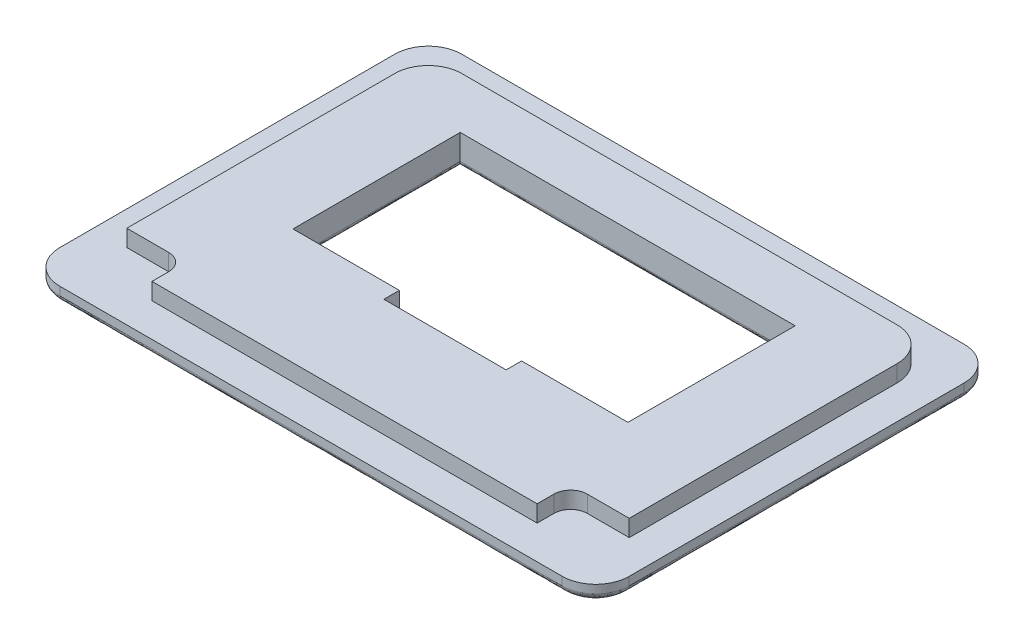
from build123d import *

# Parameters (mm, degrees)
BOSS_EXTRUDE1_DEPTH = 2
BOSS_EXTRUDE2_DEPTH = 1
CUT_EXTRUDE1_DEPTH  = 21.90454496
CUT_EXTRUDE2_DEPTH  = 1
FILLET2_SIZE        = 0.5


with BuildPart() as part:
    # Sketch4 → Boss-Extrude1 (new body)
    with BuildSketch(Plane(origin=(0, 0, 0), x_dir=(1, 0, 0), z_dir=(0, 1, 0))):
        with BuildLine():
            Line((-11.5, -10), (11.5, -10))
            Line((11.5, -10), (11.5, -9))
            ThreePointArc((11.5, -9), (11.792893219, -8.292893219), (12.5, -8))
            Line((12.5, -8), (15, -8))
            Line((15, -8), (15, 8))
            ThreePointArc((15, 8), (14.414213562, 9.414213562), (13, 10))
            Line((13, 10), (-13, 10))
            ThreePointArc((-13, 10), (-14.414213562, 9.414213562), (-15, 8))
            Line((-15, 8), (-15, -8))
            Line((-15, -8), (-12.5, -8))
            ThreePointArc((-12.5, -8), (-11.792893219, -8.292893219), (-11.5, -9))
            Line((-11.5, -9), (-11.5, -10))
        make_face()
    extrude(amount=BOSS_EXTRUDE1_DEPTH)

    # Sketch3 → Boss-Extrude2 (add)
    with BuildSketch(Plane(origin=(0, 0, 0), x_dir=(1, 0, 0), z_dir=(0, 1, 0))):
        with BuildLine():
            Line((-15, -12), (15, -12))
            ThreePointArc((15, -12), (16.414213562, -11.414213562), (17, -10))
            Line((17, -10), (17, 10))
            ThreePointArc((17, 10), (16.414213562, 11.414213562), (15, 12))
            Line((15, 12), (-15, 12))
            ThreePointArc((-15, 12), (-16.414213562, 11.414213562), (-17, 10))
            Line((-17, 10), (-17, -10))
            ThreePointArc((-17, -10), (-16.414213562, -11.414213562), (-15, -12))
        make_face()
    extrude(amount=BOSS_EXTRUDE2_DEPTH)

    # Sketch5 → Cut-Extrude1 (cut, through all)
    with BuildSketch(Plane(origin=(0, 2, 0), x_dir=(1, 0, 0), z_dir=(0, 1, 0))):
        Polygon((-3.65, -4), (3.65, -4), (3.65, -3.07690339), (10, -3.07690339), (10, 6.907955435), (-10, 6.907955435), (-10, -3.07690339), (-3.65, -3.07690339), align=None)
    extrude(amount=-CUT_EXTRUDE1_DEPTH, mode=Mode.SUBTRACT)

    # Sketch7 → Cut-Extrude2 (cut)
    with BuildSketch(Plane.XZ):
        Polygon((-4.219296387, 3.374825997), (-3.922380048, 3.374825997), (-3.922380048, 4.304303233), (3.922380048, 4.304303233), (3.922380048, 3.374825997), (4.219296387, 3.374825997), (4.219296387, 0.844582412), (-4.219296387, 0.844582412), align=None)
    extrude(amount=-CUT_EXTRUDE2_DEPTH, mode=Mode.SUBTRACT)

    # Fillet2
    # a fillet whose section is not a circle: 0.5 mm, written as the material it takes off along each edge
    with BuildSketch(Plane(origin=(17, 0, 10), x_dir=(-1, 0, 0), z_dir=(0, 0, -1)), Plane(origin=(-17, 0, -10), x_dir=(1, 0, 0), z_dir=(0, 0, 1))) as fillet2_piece_1:
        with BuildLine():
            Bezier((FILLET2_SIZE, 0), (0, 0), (0, FILLET2_SIZE), weights=[1, 0.353553391, 1])
            Line((0, FILLET2_SIZE), (0, 0))
            Line((0, 0), (FILLET2_SIZE, 0))
        make_face()
    extrude(amount=20, mode=Mode.SUBTRACT)
    with BuildSketch(Plane(origin=(15, 0, -10), x_dir=(1, 0, 0), z_dir=(0, 0, 1))) as fillet2_piece_2:
        with BuildLine():
            Bezier((2 - FILLET2_SIZE, 0), (2, 0), (2, FILLET2_SIZE), weights=[1, 0.353553391, 1])
            Line((2, FILLET2_SIZE), (2, 0))
            Line((2, 0), (2 - FILLET2_SIZE, 0))
        make_face()
    revolve(axis=Axis((15, 0, -10), (0, 1, 0)), revolution_arc=90, mode=Mode.SUBTRACT)
    with BuildSketch(Plane(origin=(15, 0, -12), x_dir=(0, 0, 1), z_dir=(-1, 0, 0)), Plane(origin=(-15, 0, 12), x_dir=(0, 0, -1), z_dir=(1, 0, 0))) as fillet2_piece_3:
        with BuildLine():
            Bezier((FILLET2_SIZE, 0), (0, 0), (0, FILLET2_SIZE), weights=[1, 0.353553391, 1])
            Line((0, FILLET2_SIZE), (0, 0))
            Line((0, 0), (FILLET2_SIZE, 0))
        make_face()
    extrude(amount=30, mode=Mode.SUBTRACT)
    with BuildSketch(Plane(origin=(-15, 0, -10), x_dir=(0, 0, -1), z_dir=(1, 0, 0))) as fillet2_piece_4:
        with BuildLine():
            Bezier((2 - FILLET2_SIZE, 0), (2, 0), (2, FILLET2_SIZE), weights=[1, 0.353553391, 1])
            Line((2, FILLET2_SIZE), (2, 0))
            Line((2, 0), (2 - FILLET2_SIZE, 0))
        make_face()
    revolve(axis=Axis((-15, 0, -10), (0, 1, 0)), revolution_arc=90, mode=Mode.SUBTRACT)
    with BuildSketch(Plane(origin=(-15, 0, 10), x_dir=(-1, 0, 0), z_dir=(0, 0, -1))) as fillet2_piece_5:
        with BuildLine():
            Bezier((2 - FILLET2_SIZE, 0), (2, 0), (2, FILLET2_SIZE), weights=[1, 0.353553391, 1])
            Line((2, FILLET2_SIZE), (2, 0))
            Line((2, 0), (2 - FILLET2_SIZE, 0))
        make_face()
    revolve(axis=Axis((-15, 0, 10), (0, 1, 0)), revolution_arc=90, mode=Mode.SUBTRACT)
    with BuildSketch(Plane(origin=(15, 0, 10), x_dir=(0, 0, 1), z_dir=(-1, 0, 0))) as fillet2_piece_6:
        with BuildLine():
            Bezier((2 - FILLET2_SIZE, 0), (2, 0), (2, FILLET2_SIZE), weights=[1, 0.353553391, 1])
            Line((2, FILLET2_SIZE), (2, 0))
            Line((2, 0), (2 - FILLET2_SIZE, 0))
        make_face()
    revolve(axis=Axis((15, 0, 10), (0, 1, 0)), revolution_arc=90, mode=Mode.SUBTRACT)
    with BuildSketch(Plane(origin=(4.219296387, 0, 3.374825997), x_dir=(1, 0, 0), z_dir=(0, 0, -1)), Plane(origin=(-4.219296387, 0, 1.82690339), x_dir=(-1, 0, 0), z_dir=(0, 0, 1))) as fillet2_piece_7:
        with BuildLine():
            Bezier((FILLET2_SIZE, 0), (0, 0), (0, -FILLET2_SIZE), weights=[1, 0.353553391, 1])
            Line((0, -FILLET2_SIZE), (0, 0))
            Line((0, 0), (FILLET2_SIZE, 0))
        make_face()
    extrude(amount=1.547922607, mode=Mode.SUBTRACT)
    with BuildSketch(Plane(origin=(2.672380048, 0, 3.374825997), x_dir=(0, 0, 1), z_dir=(1, 0, 0)), Plane(origin=(-4.219296387, 0, 3.374825997), x_dir=(0, 0, 1), z_dir=(1, 0, 0))) as fillet2_piece_8:
        with BuildLine():
            Bezier((FILLET2_SIZE, 0), (0, 0), (0, -FILLET2_SIZE), weights=[1, 0.353553391, 1])
            Line((0, -FILLET2_SIZE), (0, 0))
            Line((0, 0), (FILLET2_SIZE, 0))
        make_face()
    extrude(amount=1.546916339, mode=Mode.SUBTRACT)
    with BuildSketch(Plane(origin=(3.922380048, 0, 4.304303233), x_dir=(1, 0, 0), z_dir=(0, 0, -1)), Plane(origin=(-3.922380048, 0, 2.124825997), x_dir=(-1, 0, 0), z_dir=(0, 0, 1))) as fillet2_piece_9:
        with BuildLine():
            Bezier((FILLET2_SIZE, 0), (0, 0), (0, -FILLET2_SIZE), weights=[1, 0.353553391, 1])
            Line((0, -FILLET2_SIZE), (0, 0))
            Line((0, 0), (FILLET2_SIZE, 0))
        make_face()
    extrude(amount=2.179477235, mode=Mode.SUBTRACT)
    with BuildSketch(Plane(origin=(-3.922380048, 0, 4.304303233), x_dir=(0, 0, 1), z_dir=(1, 0, 0))) as fillet2_piece_10:
        with BuildLine():
            Bezier((FILLET2_SIZE, 0), (0, 0), (0, -FILLET2_SIZE), weights=[1, 0.353553391, 1])
            Line((0, -FILLET2_SIZE), (0, 0))
            Line((0, 0), (FILLET2_SIZE, 0))
        make_face()
    extrude(amount=7.844760096, mode=Mode.SUBTRACT)
    with BuildSketch(Plane(origin=(-10, 0, -6.907955435), x_dir=(-1, 0, 0), z_dir=(0, 0, 1)), Plane(origin=(10, 0, 3.07690339), x_dir=(1, 0, 0), z_dir=(0, 0, -1))) as fillet2_piece_11:
        with BuildLine():
            Bezier((FILLET2_SIZE, 0), (0, 0), (0, -FILLET2_SIZE), weights=[1, 0.353553391, 1])
            Line((0, -FILLET2_SIZE), (0, 0))
            Line((0, 0), (FILLET2_SIZE, 0))
        make_face()
    extrude(amount=9.984858825, mode=Mode.SUBTRACT)
    with BuildSketch(Plane(origin=(10, 0, -6.907955435), x_dir=(0, 0, -1), z_dir=(-1, 0, 0))) as fillet2_piece_12:
        with BuildLine():
            Bezier((FILLET2_SIZE, 0), (0, 0), (0, -FILLET2_SIZE), weights=[1, 0.353553391, 1])
            Line((0, -FILLET2_SIZE), (0, 0))
            Line((0, 0), (FILLET2_SIZE, 0))
        make_face()
    extrude(amount=20, mode=Mode.SUBTRACT)
    with BuildSketch(Plane(origin=(2.969296387, 0, 3.07690339), x_dir=(0, 0, 1), z_dir=(1, 0, 0)), Plane(origin=(-10, 0, 3.07690339), x_dir=(0, 0, 1), z_dir=(1, 0, 0))) as fillet2_piece_13:
        with BuildLine():
            Bezier((FILLET2_SIZE, 0), (0, 0), (0, -FILLET2_SIZE), weights=[1, 0.353553391, 1])
            Line((0, -FILLET2_SIZE), (0, 0))
            Line((0, 0), (FILLET2_SIZE, 0))
        make_face()
    extrude(amount=7.030703613, mode=Mode.SUBTRACT)
    with BuildSketch(Plane(origin=(2.672380048, 0, 3.374825997), x_dir=(0, 0, 1), z_dir=(1, 0, 0))) as fillet2_piece_14a_section:
        with BuildLine():
            Bezier((FILLET2_SIZE, 0), (0, 0), (0, -FILLET2_SIZE), weights=[1, 0.353553391, 1])
            Line((0, -FILLET2_SIZE), (0, 0))
            Line((0, 0), (FILLET2_SIZE, 0))
        make_face()
    fillet2_piece_14a = extrude(amount=2.796916339, mode=Mode.PRIVATE)
    fillet2_piece_14a = split(fillet2_piece_14a, bisect_by=Plane(origin=(4.219296387, 0, 3.374825997), z_dir=(1, 0, 0)), keep=Keep.TOP, mode=Mode.PRIVATE)
    with BuildSketch(Plane(origin=(4.219296387, 0, 4.624825997), x_dir=(1, 0, 0), z_dir=(0, 0, -1))) as fillet2_piece_14b_section:
        with BuildLine():
            Bezier((FILLET2_SIZE, 0), (0, 0), (0, -FILLET2_SIZE), weights=[1, 0.353553391, 1])
            Line((0, -FILLET2_SIZE), (0, 0))
            Line((0, 0), (FILLET2_SIZE, 0))
        make_face()
    fillet2_piece_14b = extrude(amount=2.797922607, mode=Mode.PRIVATE)
    fillet2_piece_14b = split(fillet2_piece_14b, bisect_by=Plane(origin=(4.219296387, 0, 3.374825997), z_dir=(0, 0, 1)), keep=Keep.TOP, mode=Mode.PRIVATE)
    fillet2_piece_14 = fillet2_piece_14a & fillet2_piece_14b
    add(fillet2_piece_14, mode=Mode.SUBTRACT)
    with BuildSketch(Plane(origin=(-3.922380048, 0, 4.304303233), x_dir=(0, 0, 1), z_dir=(1, 0, 0))) as fillet2_piece_15a_section:
        with BuildLine():
            Bezier((FILLET2_SIZE, 0), (0, 0), (0, -FILLET2_SIZE), weights=[1, 0.353553391, 1])
            Line((0, -FILLET2_SIZE), (0, 0))
            Line((0, 0), (FILLET2_SIZE, 0))
        make_face()
    fillet2_piece_15a = extrude(amount=9.094760096, mode=Mode.PRIVATE)
    fillet2_piece_15a = split(fillet2_piece_15a, bisect_by=Plane(origin=(3.922380048, 0, 4.304303233), z_dir=(1, 0, 0)), keep=Keep.TOP, mode=Mode.PRIVATE)
    with BuildSketch(Plane(origin=(3.922380048, 0, 5.554303233), x_dir=(1, 0, 0), z_dir=(0, 0, -1))) as fillet2_piece_15b_section:
        with BuildLine():
            Bezier((FILLET2_SIZE, 0), (0, 0), (0, -FILLET2_SIZE), weights=[1, 0.353553391, 1])
            Line((0, -FILLET2_SIZE), (0, 0))
            Line((0, 0), (FILLET2_SIZE, 0))
        make_face()
    fillet2_piece_15b = extrude(amount=3.429477235, mode=Mode.PRIVATE)
    fillet2_piece_15b = split(fillet2_piece_15b, bisect_by=Plane(origin=(3.922380048, 0, 4.304303233), z_dir=(0, 0, 1)), keep=Keep.TOP, mode=Mode.PRIVATE)
    fillet2_piece_15 = fillet2_piece_15a & fillet2_piece_15b
    add(fillet2_piece_15, mode=Mode.SUBTRACT)
    with BuildSketch(Plane(origin=(-3.922380048, 0, 2.124825997), x_dir=(-1, 0, 0), z_dir=(0, 0, 1))) as fillet2_piece_16a_section:
        with BuildLine():
            Bezier((FILLET2_SIZE, 0), (0, 0), (0, -FILLET2_SIZE), weights=[1, 0.353553391, 1])
            Line((0, -FILLET2_SIZE), (0, 0))
            Line((0, 0), (FILLET2_SIZE, 0))
        make_face()
    fillet2_piece_16a = extrude(amount=3.429477235, mode=Mode.PRIVATE)
    fillet2_piece_16a = split(fillet2_piece_16a, bisect_by=Plane(origin=(-3.922380048, 0, 4.304303233), z_dir=(0, 0, 1)), keep=Keep.TOP, mode=Mode.PRIVATE)
    with BuildSketch(Plane(origin=(-5.172380048, 0, 4.304303233), x_dir=(0, 0, 1), z_dir=(1, 0, 0))) as fillet2_piece_16b_section:
        with BuildLine():
            Bezier((FILLET2_SIZE, 0), (0, 0), (0, -FILLET2_SIZE), weights=[1, 0.353553391, 1])
            Line((0, -FILLET2_SIZE), (0, 0))
            Line((0, 0), (FILLET2_SIZE, 0))
        make_face()
    fillet2_piece_16b = extrude(amount=9.094760096, mode=Mode.PRIVATE)
    fillet2_piece_16b = split(fillet2_piece_16b, bisect_by=Plane(origin=(-3.922380048, 0, 4.304303233), z_dir=(-1, 0, 0)), keep=Keep.TOP, mode=Mode.PRIVATE)
    fillet2_piece_16 = fillet2_piece_16a & fillet2_piece_16b
    add(fillet2_piece_16, mode=Mode.SUBTRACT)
    with BuildSketch(Plane(origin=(-4.219296387, 0, 1.82690339), x_dir=(-1, 0, 0), z_dir=(0, 0, 1))) as fillet2_piece_17a_section:
        with BuildLine():
            Bezier((FILLET2_SIZE, 0), (0, 0), (0, -FILLET2_SIZE), weights=[1, 0.353553391, 1])
            Line((0, -FILLET2_SIZE), (0, 0))
            Line((0, 0), (FILLET2_SIZE, 0))
        make_face()
    fillet2_piece_17a = extrude(amount=2.797922607, mode=Mode.PRIVATE)
    fillet2_piece_17a = split(fillet2_piece_17a, bisect_by=Plane(origin=(-4.219296387, 0, 3.374825997), z_dir=(0, 0, 1)), keep=Keep.TOP, mode=Mode.PRIVATE)
    with BuildSketch(Plane(origin=(-5.469296387, 0, 3.374825997), x_dir=(0, 0, 1), z_dir=(1, 0, 0))) as fillet2_piece_17b_section:
        with BuildLine():
            Bezier((FILLET2_SIZE, 0), (0, 0), (0, -FILLET2_SIZE), weights=[1, 0.353553391, 1])
            Line((0, -FILLET2_SIZE), (0, 0))
            Line((0, 0), (FILLET2_SIZE, 0))
        make_face()
    fillet2_piece_17b = extrude(amount=2.796916339, mode=Mode.PRIVATE)
    fillet2_piece_17b = split(fillet2_piece_17b, bisect_by=Plane(origin=(-4.219296387, 0, 3.374825997), z_dir=(-1, 0, 0)), keep=Keep.TOP, mode=Mode.PRIVATE)
    fillet2_piece_17 = fillet2_piece_17a & fillet2_piece_17b
    add(fillet2_piece_17, mode=Mode.SUBTRACT)
    with BuildSketch(Plane(origin=(10, 0, -6.907955435), x_dir=(0, 0, -1), z_dir=(-1, 0, 0))) as fillet2_piece_18a_section:
        with BuildLine():
            Bezier((FILLET2_SIZE, 0), (0, 0), (0, -FILLET2_SIZE), weights=[1, 0.353553391, 1])
            Line((0, -FILLET2_SIZE), (0, 0))
            Line((0, 0), (FILLET2_SIZE, 0))
        make_face()
    fillet2_piece_18a = extrude(amount=21.25, mode=Mode.PRIVATE)
    fillet2_piece_18a = split(fillet2_piece_18a, bisect_by=Plane(origin=(-10, 0, -6.907955435), z_dir=(-1, 0, 0)), keep=Keep.TOP, mode=Mode.PRIVATE)
    with BuildSketch(Plane(origin=(-10, 0, -8.157955435), x_dir=(-1, 0, 0), z_dir=(0, 0, 1))) as fillet2_piece_18b_section:
        with BuildLine():
            Bezier((FILLET2_SIZE, 0), (0, 0), (0, -FILLET2_SIZE), weights=[1, 0.353553391, 1])
            Line((0, -FILLET2_SIZE), (0, 0))
            Line((0, 0), (FILLET2_SIZE, 0))
        make_face()
    fillet2_piece_18b = extrude(amount=11.234858825, mode=Mode.PRIVATE)
    fillet2_piece_18b = split(fillet2_piece_18b, bisect_by=Plane(origin=(-10, 0, -6.907955435), z_dir=(0, 0, -1)), keep=Keep.TOP, mode=Mode.PRIVATE)
    fillet2_piece_18 = fillet2_piece_18a & fillet2_piece_18b
    add(fillet2_piece_18, mode=Mode.SUBTRACT)
    with BuildSketch(Plane(origin=(-10, 0, -6.907955435), x_dir=(-1, 0, 0), z_dir=(0, 0, 1))) as fillet2_piece_19a_section:
        with BuildLine():
            Bezier((FILLET2_SIZE, 0), (0, 0), (0, -FILLET2_SIZE), weights=[1, 0.353553391, 1])
            Line((0, -FILLET2_SIZE), (0, 0))
            Line((0, 0), (FILLET2_SIZE, 0))
        make_face()
    fillet2_piece_19a = extrude(amount=11.234858825, mode=Mode.PRIVATE)
    fillet2_piece_19a = split(fillet2_piece_19a, bisect_by=Plane(origin=(-10, 0, 3.07690339), z_dir=(0, 0, 1)), keep=Keep.TOP, mode=Mode.PRIVATE)
    with BuildSketch(Plane(origin=(-11.25, 0, 3.07690339), x_dir=(0, 0, 1), z_dir=(1, 0, 0))) as fillet2_piece_19b_section:
        with BuildLine():
            Bezier((FILLET2_SIZE, 0), (0, 0), (0, -FILLET2_SIZE), weights=[1, 0.353553391, 1])
            Line((0, -FILLET2_SIZE), (0, 0))
            Line((0, 0), (FILLET2_SIZE, 0))
        make_face()
    fillet2_piece_19b = extrude(amount=8.280703613, mode=Mode.PRIVATE)
    fillet2_piece_19b = split(fillet2_piece_19b, bisect_by=Plane(origin=(-10, 0, 3.07690339), z_dir=(-1, 0, 0)), keep=Keep.TOP, mode=Mode.PRIVATE)
    fillet2_piece_19 = fillet2_piece_19a & fillet2_piece_19b
    add(fillet2_piece_19, mode=Mode.SUBTRACT)
    with BuildSketch(Plane(origin=(10, 0, 3.07690339), x_dir=(1, 0, 0), z_dir=(0, 0, -1))) as fillet2_piece_20a_section:
        with BuildLine():
            Bezier((FILLET2_SIZE, 0), (0, 0), (0, -FILLET2_SIZE), weights=[1, 0.353553391, 1])
            Line((0, -FILLET2_SIZE), (0, 0))
            Line((0, 0), (FILLET2_SIZE, 0))
        make_face()
    fillet2_piece_20a = extrude(amount=11.234858825, mode=Mode.PRIVATE)
    fillet2_piece_20a = split(fillet2_piece_20a, bisect_by=Plane(origin=(10, 0, -6.907955435), z_dir=(0, 0, -1)), keep=Keep.TOP, mode=Mode.PRIVATE)
    with BuildSketch(Plane(origin=(11.25, 0, -6.907955435), x_dir=(0, 0, -1), z_dir=(-1, 0, 0))) as fillet2_piece_20b_section:
        with BuildLine():
            Bezier((FILLET2_SIZE, 0), (0, 0), (0, -FILLET2_SIZE), weights=[1, 0.353553391, 1])
            Line((0, -FILLET2_SIZE), (0, 0))
            Line((0, 0), (FILLET2_SIZE, 0))
        make_face()
    fillet2_piece_20b = extrude(amount=21.25, mode=Mode.PRIVATE)
    fillet2_piece_20b = split(fillet2_piece_20b, bisect_by=Plane(origin=(10, 0, -6.907955435), z_dir=(1, 0, 0)), keep=Keep.TOP, mode=Mode.PRIVATE)
    fillet2_piece_20 = fillet2_piece_20a & fillet2_piece_20b
    add(fillet2_piece_20, mode=Mode.SUBTRACT)
    with BuildSketch(Plane(origin=(2.969296387, 0, 3.07690339), x_dir=(0, 0, 1), z_dir=(1, 0, 0))) as fillet2_piece_21a_section:
        with BuildLine():
            Bezier((FILLET2_SIZE, 0), (0, 0), (0, -FILLET2_SIZE), weights=[1, 0.353553391, 1])
            Line((0, -FILLET2_SIZE), (0, 0))
            Line((0, 0), (FILLET2_SIZE, 0))
        make_face()
    fillet2_piece_21a = extrude(amount=8.280703613, mode=Mode.PRIVATE)
    fillet2_piece_21a = split(fillet2_piece_21a, bisect_by=Plane(origin=(10, 0, 3.07690339), z_dir=(1, 0, 0)), keep=Keep.TOP, mode=Mode.PRIVATE)
    with BuildSketch(Plane(origin=(10, 0, 4.32690339), x_dir=(1, 0, 0), z_dir=(0, 0, -1))) as fillet2_piece_21b_section:
        with BuildLine():
            Bezier((FILLET2_SIZE, 0), (0, 0), (0, -FILLET2_SIZE), weights=[1, 0.353553391, 1])
            Line((0, -FILLET2_SIZE), (0, 0))
            Line((0, 0), (FILLET2_SIZE, 0))
        make_face()
    fillet2_piece_21b = extrude(amount=11.234858825, mode=Mode.PRIVATE)
    fillet2_piece_21b = split(fillet2_piece_21b, bisect_by=Plane(origin=(10, 0, 3.07690339), z_dir=(0, 0, 1)), keep=Keep.TOP, mode=Mode.PRIVATE)
    fillet2_piece_21 = fillet2_piece_21a & fillet2_piece_21b
    add(fillet2_piece_21, mode=Mode.SUBTRACT)


solid = part.part
